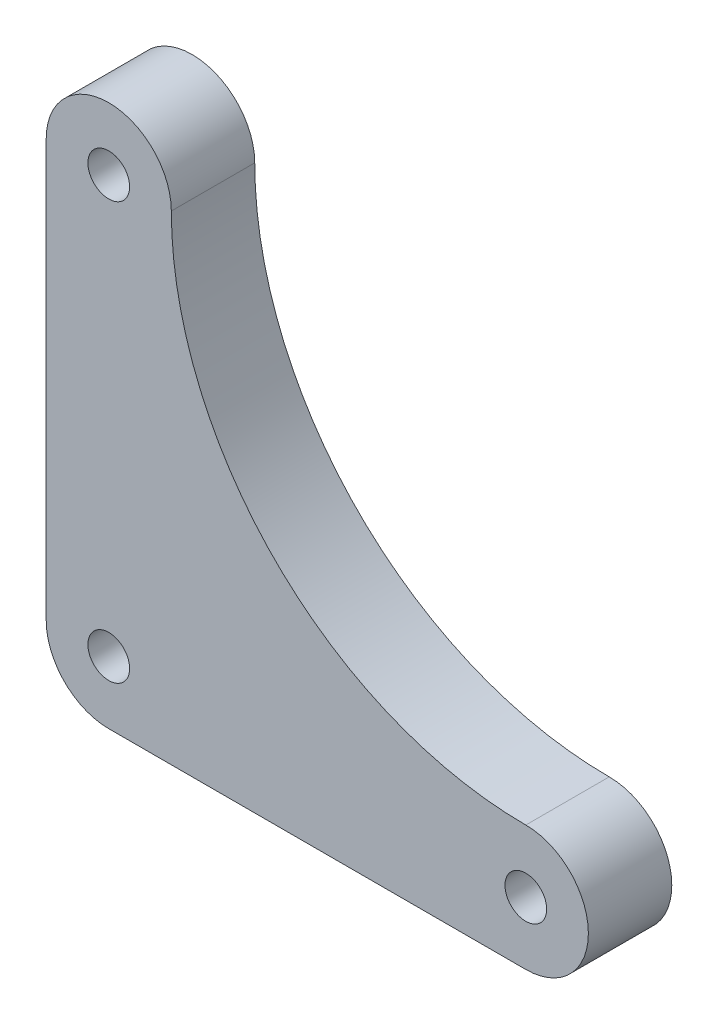
from build123d import *

# Parameters (mm, degrees)
SKETCH1_R           = 2.5
BOSS_EXTRUDE1_DEPTH = 10


with BuildPart() as part:
    # Sketch1 → Boss-Extrude1 (new body)
    with BuildSketch(Plane.XY):
        with BuildLine():
            Line((-7.5, 0), (-7.5, 50))
            ThreePointArc((-7.5, 50), (0, 57.5), (7.5, 50))
            ThreePointArc((7.5, 50), (19.9479618, 19.9479618), (50, 7.5))
            ThreePointArc((50, 7.5), (57.5, 0), (50, -7.5))
            Line((50, -7.5), (0, -7.5))
            ThreePointArc((0, -7.5), (-5.303300859, -5.303300859), (-7.5, 0))
        make_face()
        Circle(SKETCH1_R, mode=Mode.SUBTRACT)
        with Locations((50, 0)):
            Circle(SKETCH1_R, mode=Mode.SUBTRACT)
        with Locations((0, 50)):
            Circle(SKETCH1_R, mode=Mode.SUBTRACT)
    extrude(amount=BOSS_EXTRUDE1_DEPTH)


solid = part.part
